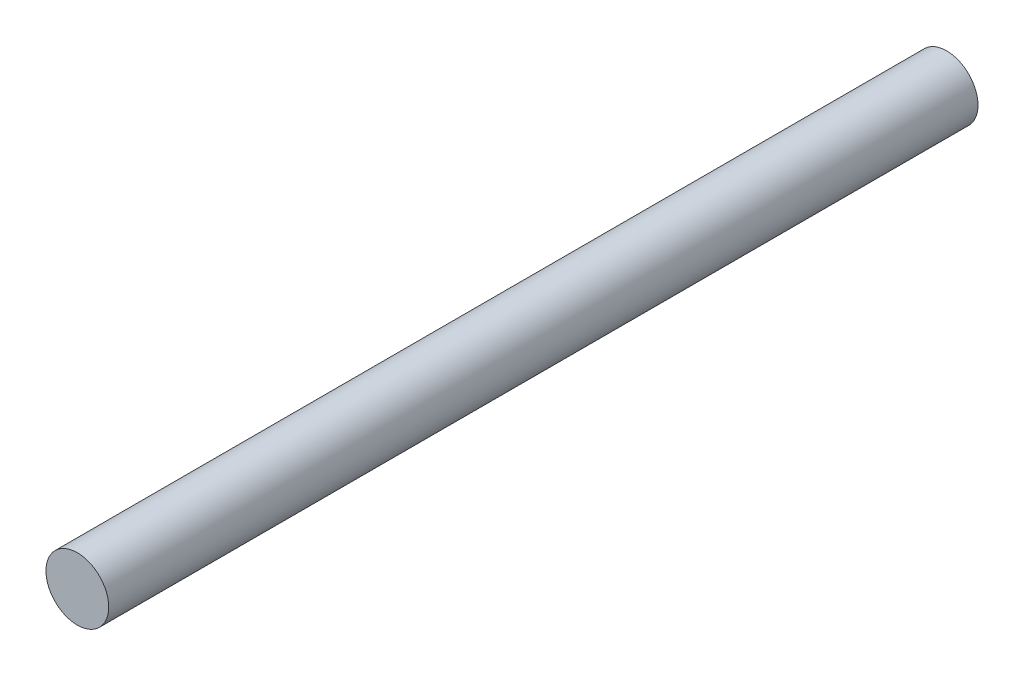
from build123d import *

# Parameters (mm, degrees)
SKETCH2_R           = 1.985
BOSS_EXTRUDE1_DEPTH = 55


with BuildPart() as part:
    # Sketch2 → Boss-Extrude1 (new body)
    with BuildSketch(Plane.XY):
        Circle(SKETCH2_R)
    extrude(amount=BOSS_EXTRUDE1_DEPTH)


solid = part.part
